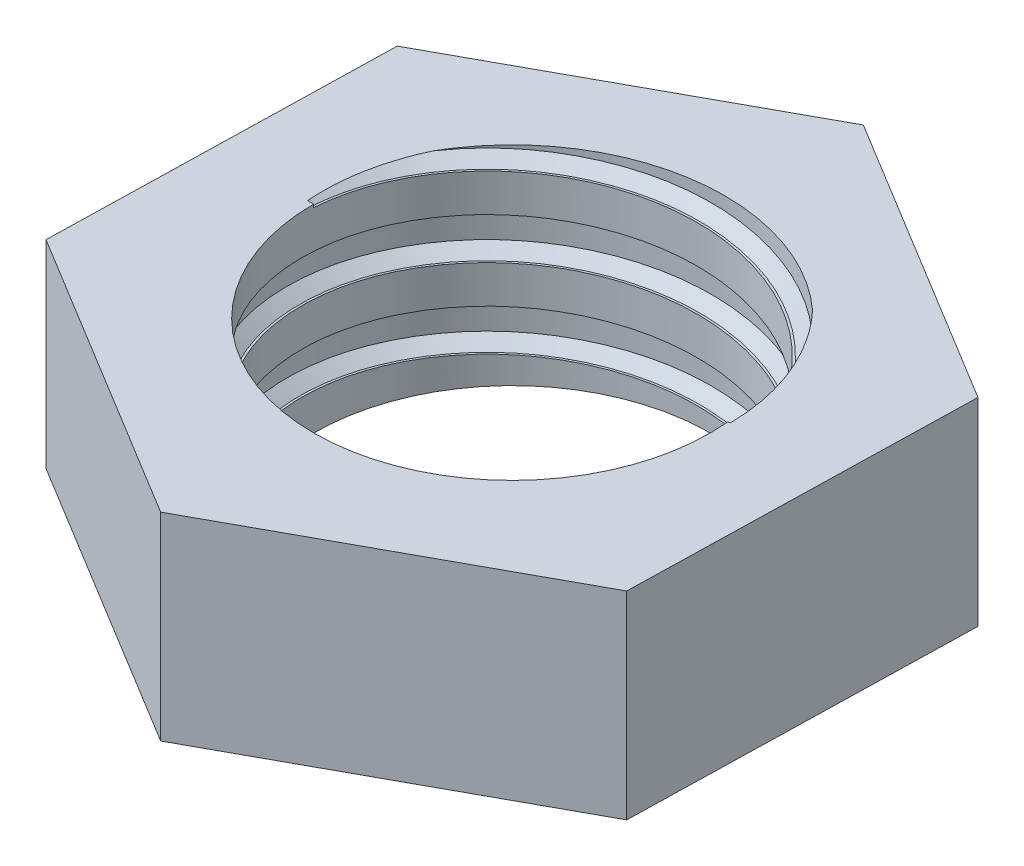
from build123d import *

# Parameters (mm, degrees)
BOSS_EXTRUDE1_DEPTH = 5
SKETCH3_R           = 5
CUT_EXTRUDE1_DEPTH  = 5
CUT_SWEEP1_PITCH    = 2


with BuildPart() as part:
    # Sketch2 → Boss-Extrude1 (new body)
    with BuildSketch(Plane(origin=(0, 0, 0), x_dir=(1, 0, 0), z_dir=(0, 1, 0))):
        Polygon((-7.396660747, 4.504376737), (-7.599235056, -4.153507742), (-0.202574309, -8.657884479), (7.396660747, -4.504376737), (7.599235056, 4.153507742), (0.202574309, 8.657884479), align=None)
    extrude(amount=BOSS_EXTRUDE1_DEPTH)

    # Sketch3 → Cut-Extrude1 (cut)
    with BuildSketch(Plane(origin=(0, 5, 0), x_dir=(1, 0, 0), z_dir=(0, 1, 0))):
        with Locations(Location((0, 0, 0), (0, 0, 270))):
            Circle(SKETCH3_R)
    extrude(amount=-CUT_EXTRUDE1_DEPTH, mode=Mode.SUBTRACT)

    # Cut-Sweep1: arcs per turn and ends read off the stored shape
    # Cut-Sweep1: the profile of Sketch6 screwed along a right-hand helix through 29 turns, 10 arcs to a turn; built about Z, then put on its axis
    cut_sweep1_z = Axis((0, 0, 0), (0, 0, 1))
    cut_sweep1_corners = [(4.978620388, 8.69e-07, 0.029335335), (5.056019953, 8.82e-07, 0.029335335), (5.366346884, 9.37e-07, 0.265187306), (5.366346884, 9.37e-07, 0.833212121), (5.056019953, 8.82e-07, 1.077310383), (4.978620388, 8.69e-07, 1.077310383)]
    with BuildLine(mode=Mode.PRIVATE) as cut_sweep1_profile:
        Line(cut_sweep1_corners[0], cut_sweep1_corners[1])
        Line(cut_sweep1_corners[1], cut_sweep1_corners[2])
        Line(cut_sweep1_corners[2], cut_sweep1_corners[3])
        Line(cut_sweep1_corners[3], cut_sweep1_corners[4])
        Line(cut_sweep1_corners[4], cut_sweep1_corners[5])
        Line(cut_sweep1_corners[5], cut_sweep1_corners[0])
    cut_sweep1_cap = Face(cut_sweep1_profile.wire())
    cut_sweep1_turn_angles = [0, 18, 36, 54, 72, 90, 108, 126, 144, 162, 180, 198, 216, 234, 252, 270, 288, 306, 324, 342, 360]
    cut_sweep1_turn_weights = [1, 0.9510565162951535, 1, 0.9510565162951535, 1, 0.9510565162951535, 1, 0.9510565162951535, 1, 0.9510565162951535, 1, 0.9510565162951535, 1, 0.9510565162951535, 1, 0.9510565162951535, 1, 0.9510565162951535, 1, 0.9510565162951535, 1]
    cut_sweep1_turn_rails = [Edge.make_bspline([Vector(p[0], p[1], 0).rotate(cut_sweep1_z, cut_sweep1_turn_angles[k]) / cut_sweep1_turn_weights[k] + Vector(0, 0, p[2] + CUT_SWEEP1_PITCH * cut_sweep1_turn_angles[k] / 360) for k in range(21)], [0, 0, 0, 1, 1, 2, 2, 3, 3, 4, 4, 5, 5, 6, 6, 7, 7, 8, 8, 9, 9, 10, 10, 10], 2, cut_sweep1_turn_weights) for p in cut_sweep1_corners]
    cut_sweep1_turn_sides = [Face.make_surface_from_curves(cut_sweep1_turn_rails[p[0]], cut_sweep1_turn_rails[p[1]]) for p in [(0, 1), (1, 2), (2, 3), (3, 4), (4, 5), (5, 0)]]
    cut_sweep1 = Plane(origin=(0, 6, 0), x_dir=(-1, 0, 0), z_dir=(0, -1, 0)) * Solid(Shell([*[p.moved(Location((0, 0, CUT_SWEEP1_PITCH * i))) for i in range(29) for p in cut_sweep1_turn_sides], cut_sweep1_cap, cut_sweep1_cap.rotate(cut_sweep1_z, 10440).moved(Location((0, 0, CUT_SWEEP1_PITCH * 10440 / 360)))]))
    add(cut_sweep1, mode=Mode.SUBTRACT)


solid = part.part
